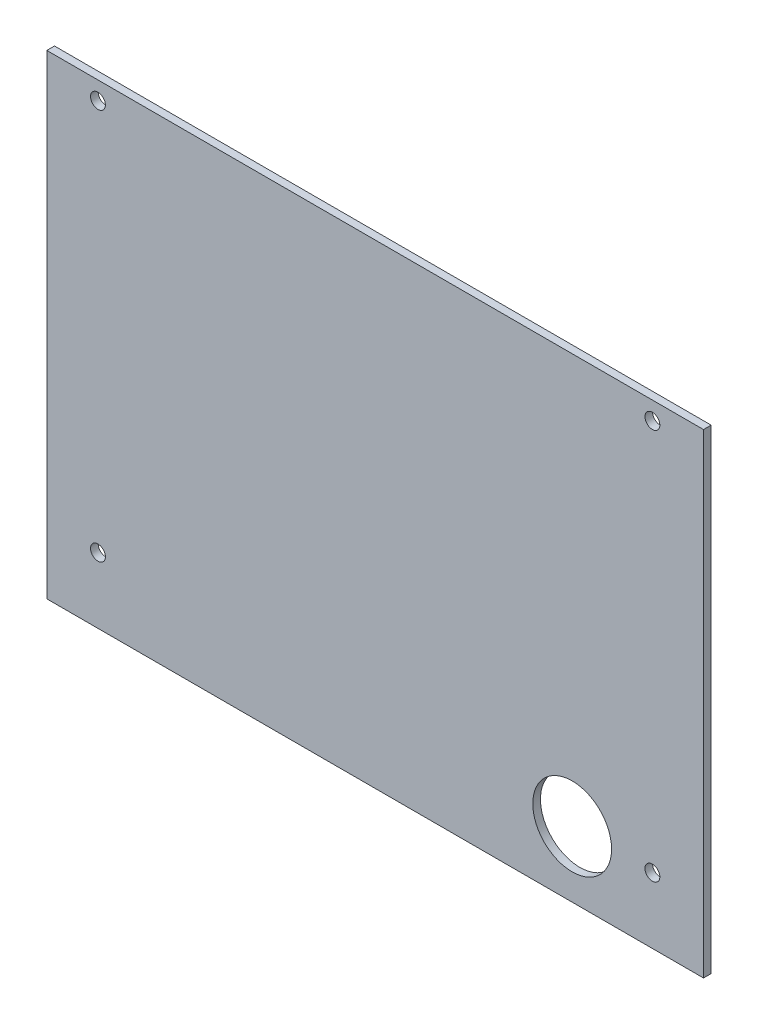
from build123d import *

# Parameters (mm, degrees)
SKETCH1_W            = 150
SKETCH1_H            = 108.5
BASE_FLANGE1_DEPTH   = 1.75
CUT_EXTRUDE1_REACH   = 128.436
SKETCH6_R            = 9
M3_CLEARANCE_HOLE1_D = 3.4


# Sheet-metal steps are written as plain solids
with BuildPart() as part:
    # Sketch1 → Base-Flange1 (new body)
    with BuildSketch(Plane.XY):
        with Locations((0, 47.52414015)):
            Rectangle(SKETCH1_W, SKETCH1_H)
    extrude(amount=-BASE_FLANGE1_DEPTH)

    # Sketch6 → Cut-Extrude1 (cut, up to next)
    with BuildSketch(Plane.XY, mode=Mode.PRIVATE) as cut_extrude1_sk1:
        with Locations((45, 8.27414015)):
            Circle(SKETCH6_R)
    cut_extrude1_tool1 = extrude(cut_extrude1_sk1.sketch, amount=-CUT_EXTRUDE1_REACH, mode=Mode.PRIVATE) & part.part
    add(cut_extrude1_tool1.solids().sort_by_distance((45, 8.27414, 0))[0], mode=Mode.SUBTRACT)

    # M3 Clearance Hole1 (through all)
    with Locations(Plane.XY):
        with Locations((63.325, 8.27414015), (63.325, 97.64914015)):
            m3_clearance_hole1 = Hole(M3_CLEARANCE_HOLE1_D / 2)

    # Mirror1: M3 Clearance Hole1 across plane
    add(m3_clearance_hole1.mirror(Plane(origin=(0, 0, 0), x_dir=(0, 0, 1), z_dir=(1, 0, 0))), mode=Mode.SUBTRACT)


solid = part.part
